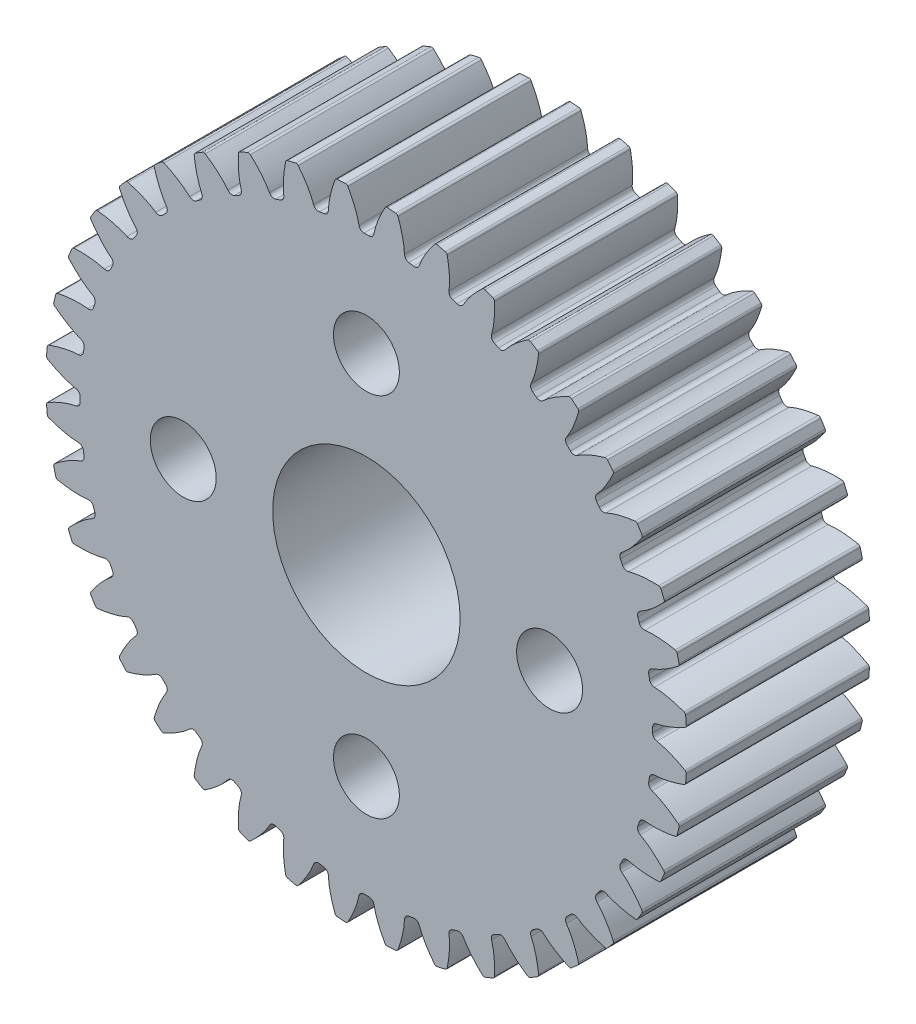
from build123d import *

# Parameters (mm, degrees)
SKETCH1_R                                 = 22.225
BOSS_EXTRUDE1_DEPTH                       = 12.7
CUT_EXTRUDE_DCLTBC_DEPTH                  = 34.89972345
FILLET_TIP_DCLTBC_R                       = 0.177538081
FILLET_ROOT_DCLTBC_R                      = 0.355076163
CIRPATTERN_DCLTBC_COUNT                   = 40
FILLET_TIP_DCLTBC_OF_CIRPATTERN_DCLTBC_R  = 0.177538081
FILLET_ROOT_DCLTBC_OF_CIRPATTERN_DCLTBC_R = 0.355076163
SKETCH4_R                                 = 6.5
CUT_EXTRUDE2_DEPTH                        = 34.837854432
SKETCH5_R                                 = 2.286
CUT_EXTRUDE3_DEPTH                        = 34.837854432


with BuildPart() as part:
    # Sketch1 → Boss-Extrude1 (new body)
    with BuildSketch(Plane.XY):
        Circle(SKETCH1_R)
    extrude(amount=BOSS_EXTRUDE1_DEPTH)

    # DCLTBC → Cut-Extrude-DCLTBC (cut, through all)
    with BuildSketch(Plane.XY):
        with BuildLine():
            Line((-0.484586237, 19.884256582), (-0.483455533, 19.837859885))
            ThreePointArc((-0.483455533, 19.837859885), (0, 19.84375), (0.483455533, 19.837859885))
            Line((0.483455533, 19.837859885), (0.484586237, 19.884256582))
            add(Edge.make_bspline(
                [(0.484586237, 19.884256582), (0.48471382, 19.887909495), (0.485191021, 19.898151672), (0.486564582, 19.917501271), (0.489475457, 19.949052179), (0.494168712, 19.989216267), (0.501365207, 20.041080676), (0.511296804, 20.10210895), (0.523734736, 20.16909756), (0.538910918, 20.241883548), (0.555505325, 20.314407202), (0.57341248, 20.386661654), (0.592471441, 20.458551144), (0.617000521, 20.545521567), (0.648418263, 20.649648215), (0.688062093, 20.771104866), (0.736471291, 20.908543152), (0.789494701, 21.048258975), (0.844698381, 21.185436997), (0.903956422, 21.323666144), (0.963758541, 21.457145906), (1.029441182, 21.595385039), (1.091882995, 21.722781296), (1.165786731, 21.865037831), (1.226579604, 21.979703352), (1.292668815, 22.097741641), (1.32532038, 22.155130416), (1.342211904, 22.184433556)],
                knots=[0, 0, 0, 0, 0, 0.005376749, 0.015083688, 0.02853182, 0.04661014, 0.064854849, 0.092110526, 0.119476176, 0.146842496, 0.174208854, 0.201574956, 0.228941013, 0.256307345, 0.307035032, 0.361767352, 0.416499661, 0.471231937, 0.525964282, 0.580696616, 0.635428982, 0.690161387, 0.744893688, 0.799626082, 0.854358407, 0.909090914, 0.909090914, 0.909090914, 0.909090914, 0.909090914], degree=4))
            ThreePointArc((1.342211904, 22.184433556), (0, 22.225), (-1.342211904, 22.184433556))
            add(Edge.make_bspline(
                [(-0.484586237, 19.884256582), (-0.48471382, 19.887909495), (-0.485191021, 19.898151672), (-0.486564582, 19.917501271), (-0.489475457, 19.949052179), (-0.494168712, 19.989216267), (-0.501365207, 20.041080676), (-0.511296804, 20.10210895), (-0.523734736, 20.16909756), (-0.538910918, 20.241883548), (-0.555505325, 20.314407202), (-0.57341248, 20.386661654), (-0.592471441, 20.458551144), (-0.617000521, 20.545521567), (-0.648418263, 20.649648215), (-0.688062093, 20.771104866), (-0.736471291, 20.908543152), (-0.789494701, 21.048258975), (-0.844698381, 21.185436997), (-0.903956422, 21.323666144), (-0.963758541, 21.457145906), (-1.029441182, 21.595385039), (-1.091882995, 21.722781296), (-1.165786731, 21.865037831), (-1.226579604, 21.979703352), (-1.292668815, 22.097741641), (-1.32532038, 22.155130416), (-1.342211904, 22.184433556)],
                knots=[0, 0, 0, 0, 0, 0.005376749, 0.015083688, 0.02853182, 0.04661014, 0.064854849, 0.092110526, 0.119476176, 0.146842496, 0.174208854, 0.201574956, 0.228941013, 0.256307345, 0.307035032, 0.361767352, 0.416499661, 0.471231937, 0.525964282, 0.580696616, 0.635428982, 0.690161387, 0.744893688, 0.799626082, 0.854358407, 0.909090914, 0.909090914, 0.909090914, 0.909090914, 0.909090914], degree=4))
        make_face()
    cut_extrude_dcltbc = extrude(amount=CUT_EXTRUDE_DCLTBC_DEPTH, mode=Mode.SUBTRACT)

    # Fillet-Tip-DCLTBC
    fillet_tip_dcltbc_edges = [part.edges().sort_by_distance(p)[0] for p in [
        (1.342211904, 22.184433556, 6.35),
        (-1.342211904, 22.184433556, 6.35),
    ]]
    fillet(fillet_tip_dcltbc_edges, radius=FILLET_TIP_DCLTBC_R)

    # Fillet-Root-DCLTBC
    fillet_root_dcltbc_edges = [part.edges().sort_by_distance(p)[0] for p in [
        (-0.483455533, 19.837859885, 6.35),
        (0.483455533, 19.837859885, 6.35),
    ]]
    fillet(fillet_root_dcltbc_edges, radius=FILLET_ROOT_DCLTBC_R)

    # CirPattern-DCLTBC: Cut-Extrude-DCLTBC ×40 about axis
    cirpattern_dcltbc_axis = Axis((0, 0, 12.7), (0, 0, 1))
    for i in range(1, CIRPATTERN_DCLTBC_COUNT):
        add(cut_extrude_dcltbc.rotate(cirpattern_dcltbc_axis, i * 360 / CIRPATTERN_DCLTBC_COUNT), mode=Mode.SUBTRACT)

    # Fillet-Tip-DCLTBC of CirPattern-DCLTBC
    fillet_tip_dcltbc_of_cirpattern_dcltbc_edges = [part.edges().sort_by_distance(p)[0] for p in [
        (-2.144722947, 22.121274567, 6.35),
        (-4.796097044, 21.701338165, 6.35),
        (-5.578847602, 21.513416382, 6.35),
        (-8.131886357, 20.683883805, 6.35),
        (-8.875602513, 20.375826487, 6.35),
        (-11.26744164, 19.157123581, 6.35),
        (-11.953810634, 18.73651612, 6.35),
        (-14.125555115, 17.158651395, 6.35),
        (-14.737676265, 16.635850543, 6.35),
        (-16.635850543, 14.737676265, 6.35),
        (-17.158651395, 14.125555115, 6.35),
        (-18.73651612, 11.953810634, 6.35),
        (-19.157123581, 11.26744164, 6.35),
        (-20.375826487, 8.875602513, 6.35),
        (-20.683883805, 8.131886357, 6.35),
        (-21.513416382, 5.578847602, 6.35),
        (-21.701338165, 4.796097044, 6.35),
        (-22.121274567, 2.144722947, 6.35),
        (-22.184433556, 1.342211904, 6.35),
        (-22.184433556, -1.342211904, 6.35),
        (-22.121274567, -2.144722947, 6.35),
        (-21.701338165, -4.796097044, 6.35),
        (-21.513416382, -5.578847602, 6.35),
        (-20.683883805, -8.131886357, 6.35),
        (-20.375826487, -8.875602513, 6.35),
        (-19.157123581, -11.26744164, 6.35),
        (-18.73651612, -11.953810634, 6.35),
        (-17.158651395, -14.125555115, 6.35),
        (-16.635850543, -14.737676265, 6.35),
        (-14.737676265, -16.635850543, 6.35),
        (-14.125555115, -17.158651395, 6.35),
        (-11.953810634, -18.73651612, 6.35),
        (-11.26744164, -19.157123581, 6.35),
        (-8.875602513, -20.375826487, 6.35),
        (-8.131886357, -20.683883805, 6.35),
        (-5.578847602, -21.513416382, 6.35),
        (-4.796097044, -21.701338165, 6.35),
        (-2.144722947, -22.121274567, 6.35),
        (-1.342211904, -22.184433556, 6.35),
        (1.342211904, -22.184433556, 6.35),
        (2.144722947, -22.121274567, 6.35),
        (4.796097044, -21.701338165, 6.35),
        (5.578847602, -21.513416382, 6.35),
        (8.131886357, -20.683883805, 6.35),
        (8.875602513, -20.375826487, 6.35),
        (11.26744164, -19.157123581, 6.35),
        (11.953810634, -18.73651612, 6.35),
        (14.125555115, -17.158651395, 6.35),
        (14.737676265, -16.635850543, 6.35),
        (16.635850543, -14.737676265, 6.35),
        (17.158651395, -14.125555115, 6.35),
        (18.73651612, -11.953810634, 6.35),
        (19.157123581, -11.26744164, 6.35),
        (20.375826487, -8.875602513, 6.35),
        (20.683883805, -8.131886357, 6.35),
        (21.513416382, -5.578847602, 6.35),
        (21.701338165, -4.796097044, 6.35),
        (22.121274567, -2.144722947, 6.35),
        (22.184433556, -1.342211904, 6.35),
        (22.184433556, 1.342211904, 6.35),
        (22.121274567, 2.144722947, 6.35),
        (21.701338165, 4.796097044, 6.35),
        (21.513416382, 5.578847602, 6.35),
        (20.683883805, 8.131886357, 6.35),
        (20.375826487, 8.875602513, 6.35),
        (19.157123581, 11.26744164, 6.35),
        (18.73651612, 11.953810634, 6.35),
        (17.158651395, 14.125555115, 6.35),
        (16.635850543, 14.737676265, 6.35),
        (14.737676265, 16.635850543, 6.35),
        (14.125555115, 17.158651395, 6.35),
        (11.953810634, 18.73651612, 6.35),
        (11.26744164, 19.157123581, 6.35),
        (8.875602513, 20.375826487, 6.35),
        (8.131886357, 20.683883805, 6.35),
        (5.578847602, 21.513416382, 6.35),
        (4.796097044, 21.701338165, 6.35),
        (2.144722947, 22.121274567, 6.35),
    ]]
    fillet(fillet_tip_dcltbc_of_cirpattern_dcltbc_edges, radius=FILLET_TIP_DCLTBC_OF_CIRPATTERN_DCLTBC_R)

    # Fillet-Root-DCLTBC of CirPattern-DCLTBC
    fillet_root_dcltbc_of_cirpattern_dcltbc_edges = [part.edges().sort_by_distance(p)[0] for p in [
        (-3.580828392, 19.517993803, 6.35),
        (-2.625821605, 19.669252018, 6.35),
        (-6.590029372, 18.717529937, 6.35),
        (-5.670442301, 19.016321889, 6.35),
        (-9.436961957, 17.456178364, 6.35),
        (-8.575437889, 17.895146802, 6.35),
        (-12.05152522, 15.764997746, 6.35),
        (-11.269277735, 16.333333811, 6.35),
        (-14.369339935, 13.685630563, 6.35),
        (-13.685630563, 14.369339935, 6.35),
        (-16.333333811, 11.269277735, 6.35),
        (-15.764997746, 12.05152522, 6.35),
        (-17.895146802, 8.575437889, 6.35),
        (-17.456178364, 9.436961957, 6.35),
        (-19.016321889, 5.670442301, 6.35),
        (-18.717529937, 6.590029372, 6.35),
        (-19.669252018, 2.625821605, 6.35),
        (-19.517993803, 3.580828392, 6.35),
        (-19.837859885, -0.483455533, 6.35),
        (-19.837859885, 0.483455533, 6.35),
        (-19.517993803, -3.580828392, 6.35),
        (-19.669252018, -2.625821605, 6.35),
        (-18.717529937, -6.590029372, 6.35),
        (-19.016321889, -5.670442301, 6.35),
        (-17.456178364, -9.436961957, 6.35),
        (-17.895146802, -8.575437889, 6.35),
        (-15.764997746, -12.05152522, 6.35),
        (-16.333333811, -11.269277735, 6.35),
        (-13.685630563, -14.369339935, 6.35),
        (-14.369339935, -13.685630563, 6.35),
        (-11.269277735, -16.333333811, 6.35),
        (-12.05152522, -15.764997746, 6.35),
        (-8.575437889, -17.895146802, 6.35),
        (-9.436961957, -17.456178364, 6.35),
        (-5.670442301, -19.016321889, 6.35),
        (-6.590029372, -18.717529937, 6.35),
        (-2.625821605, -19.669252018, 6.35),
        (-3.580828392, -19.517993803, 6.35),
        (0.483455533, -19.837859885, 6.35),
        (-0.483455533, -19.837859885, 6.35),
        (3.580828392, -19.517993803, 6.35),
        (2.625821605, -19.669252018, 6.35),
        (6.590029372, -18.717529937, 6.35),
        (5.670442301, -19.016321889, 6.35),
        (9.436961957, -17.456178364, 6.35),
        (8.575437889, -17.895146802, 6.35),
        (12.05152522, -15.764997746, 6.35),
        (11.269277735, -16.333333811, 6.35),
        (14.369339935, -13.685630563, 6.35),
        (13.685630563, -14.369339935, 6.35),
        (16.333333811, -11.269277735, 6.35),
        (15.764997746, -12.05152522, 6.35),
        (17.895146802, -8.575437889, 6.35),
        (17.456178364, -9.436961957, 6.35),
        (19.016321889, -5.670442301, 6.35),
        (18.717529937, -6.590029372, 6.35),
        (19.669252018, -2.625821605, 6.35),
        (19.517993803, -3.580828392, 6.35),
        (19.837859885, 0.483455533, 6.35),
        (19.837859885, -0.483455533, 6.35),
        (19.517993803, 3.580828392, 6.35),
        (19.669252018, 2.625821605, 6.35),
        (18.717529937, 6.590029372, 6.35),
        (19.016321889, 5.670442301, 6.35),
        (17.456178364, 9.436961957, 6.35),
        (17.895146802, 8.575437889, 6.35),
        (15.764997746, 12.05152522, 6.35),
        (16.333333811, 11.269277735, 6.35),
        (13.685630563, 14.369339935, 6.35),
        (14.369339935, 13.685630563, 6.35),
        (11.269277735, 16.333333811, 6.35),
        (12.05152522, 15.764997746, 6.35),
        (8.575437889, 17.895146802, 6.35),
        (9.436961957, 17.456178364, 6.35),
        (5.670442301, 19.016321889, 6.35),
        (6.590029372, 18.717529937, 6.35),
        (2.625821605, 19.669252018, 6.35),
        (3.580828392, 19.517993803, 6.35),
    ]]
    fillet(fillet_root_dcltbc_of_cirpattern_dcltbc_edges, radius=FILLET_ROOT_DCLTBC_OF_CIRPATTERN_DCLTBC_R)

    # Sketch4 → Cut-Extrude2 (cut, through all)
    with BuildSketch(Plane.XY.offset(12.7)):
        Circle(SKETCH4_R)
    extrude(amount=-CUT_EXTRUDE2_DEPTH, mode=Mode.SUBTRACT)

    # Sketch5 → Cut-Extrude3 (cut, through all)
    with BuildSketch(Plane.XY.offset(12.7)):
        with Locations((-12.7, 0)):
            Circle(SKETCH5_R)
        with Locations((0, 12.7)):
            Circle(SKETCH5_R)
        with Locations((12.7, 0)):
            Circle(SKETCH5_R)
        with Locations((0, -12.7)):
            Circle(SKETCH5_R)
    extrude(amount=-CUT_EXTRUDE3_DEPTH, mode=Mode.SUBTRACT)


solid = part.part
